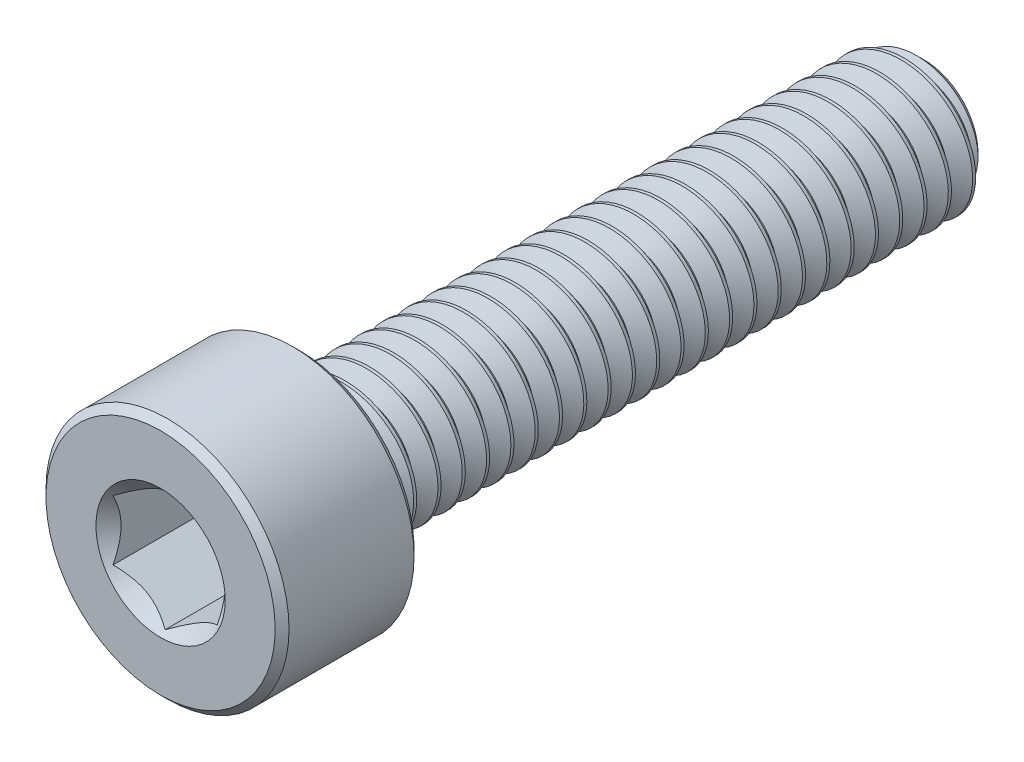
from build123d import *

# Parameters (mm, degrees)
CUT_EXTRUDE1_DEPTH     = 3
SPLIT1_SURFACE_1_BACK  = 25.125
SPLIT1_SURFACE_1_DEPTH = 50.25
SPLIT1_SURFACE_2_BACK  = 25.125
SPLIT1_SURFACE_2_DEPTH = 50.25
CUT_SWEEP1_PITCH       = 0.7
CUT_SWEEP1_TO          = 17.8


with BuildPart() as part:
    # Sketch2 → Revolve1 (revolve)
    with BuildSketch(Plane(origin=(0, 0, 0), x_dir=(0, 0, -1), z_dir=(1, 0, 0))):
        with BuildLine():
            Line((-11, 0), (-11, 3.3))
            Line((-11, 3.3), (-10.8, 3.5))
            Line((-10.8, 3.5), (-7.2, 3.5))
            Line((-7.2, 3.5), (-7, 3.3))
            Line((-7, 3.3), (-7, 2.2))
            ThreePointArc((-7, 2.2), (-6.941421356, 2.058578644), (-6.8, 2))
            Line((-6.8, 2), (10.545336663, 2))
            Line((10.545336663, 2), (11, 1.545336663))
            Line((11, 1.545336663), (11, 0))
            Line((11, 0), (-11, 0))
        make_face()
    revolve(axis=Axis((0, 0, -11), (0, 0, 1)))

    # Sketch3 → Cut-Extrude1 (cut)
    with BuildSketch(Plane.XY.offset(11)):
        Polygon((1.5, -0.866025404), (1.5, 0.866025404), (0, 1.732050808), (-1.5, 0.866025404), (-1.5, -0.866025404), (0, -1.732050808), align=None)
    extrude(amount=-CUT_EXTRUDE1_DEPTH, mode=Mode.SUBTRACT)

    # Cut-Extrude2 cone 1 section (through the dimple's axis) → Cut-Extrude2 (revolve, cut)
    with BuildSketch(Plane(origin=(0, 0, 11), x_dir=(0, -1, 0), z_dir=(1, 0, 0))):
        Polygon((0, 0), (1.861954618, 0), (0, 1.861954618), align=None)
    revolve(axis=Axis((0, 0, 11), (0, 0, -1)), mode=Mode.SUBTRACT)


with BuildPart() as body_2:
    # Split1: the piece behind the surface
    add(part.part)
    # Split1 surface: a surface, the sketch's curves swept straight by 50.25 mm
    with BuildLine(Plane(origin=(0, 0, 0), x_dir=(0, 0, -1), z_dir=(1, 0, 0)).offset(-SPLIT1_SURFACE_1_BACK), mode=Mode.PRIVATE) as split1_surface_1_path:
        Line((-6.8, -3.5), (-6.8, 3.5))
    split1_surface_1 = Shell.extrude(split1_surface_1_path.wire(), (1 * SPLIT1_SURFACE_1_DEPTH, 0 * SPLIT1_SURFACE_1_DEPTH, 0 * SPLIT1_SURFACE_1_DEPTH))
    split(bisect_by=split1_surface_1, keep=Keep.BOTTOM)

    # Cut-Sweep1: arcs per turn and ends read off the stored shape
    # Cut-Sweep1: the profile of Sketch7 screwed along a right-hand helix through 26.714286 turns, 6 arcs to a turn; built about Z, then put on its axis
    cut_sweep1_z = Axis((0, 0, 0), (0, 0, 1))
    cut_sweep1_corners = [(2.037888611, 0, 0.021875), (2.037888611, 0, -0.634375), (1.545336663, 0, -0.35), (1.545336663, 0, -0.2625)]
    with BuildLine(mode=Mode.PRIVATE) as cut_sweep1_profile:
        Line(cut_sweep1_corners[0], cut_sweep1_corners[1])
        Line(cut_sweep1_corners[1], cut_sweep1_corners[2])
        Line(cut_sweep1_corners[2], cut_sweep1_corners[3])
        Line(cut_sweep1_corners[3], cut_sweep1_corners[0])
    cut_sweep1_cap = Face(cut_sweep1_profile.wire())
    cut_sweep1_turn_angles = [0, 30, 60, 90, 120, 150, 180, 210, 240, 270, 300, 330, 360]
    cut_sweep1_turn_weights = [1, 0.8660254037844387, 1, 0.8660254037844387, 1, 0.8660254037844387, 1, 0.8660254037844387, 1, 0.8660254037844387, 1, 0.8660254037844387, 1]
    cut_sweep1_turn_rails = [Edge.make_bspline([Vector(p[0], p[1], 0).rotate(cut_sweep1_z, cut_sweep1_turn_angles[k]) / cut_sweep1_turn_weights[k] + Vector(0, 0, p[2] + CUT_SWEEP1_PITCH * cut_sweep1_turn_angles[k] / 360) for k in range(13)], [0, 0, 0, 1, 1, 2, 2, 3, 3, 4, 4, 5, 5, 6, 6, 6], 2, cut_sweep1_turn_weights) for p in cut_sweep1_corners]
    cut_sweep1_turn_sides = [Face.make_surface_from_curves(cut_sweep1_turn_rails[p[0]], cut_sweep1_turn_rails[p[1]]) for p in [(0, 1), (1, 2), (2, 3), (3, 0)]]
    cut_sweep1_last_angles = [9360, 9390, 9420, 9450, 9480, 9510, 9540, 9570, 9600, 9608.571428571, 9617.142857143]
    cut_sweep1_last_weights = [1, 0.8660254037844387, 1, 0.8660254037844387, 1, 0.8660254037844387, 1, 0.8660254037844387, 1, 0.9888308262249893, 1]
    cut_sweep1_last_rails = [Edge.make_bspline([Vector(p[0], p[1], 0).rotate(cut_sweep1_z, cut_sweep1_last_angles[k]) / cut_sweep1_last_weights[k] + Vector(0, 0, p[2] + CUT_SWEEP1_PITCH * cut_sweep1_last_angles[k] / 360) for k in range(11)], [0, 0, 0, 1, 1, 2, 2, 3, 3, 4, 4, 5, 5, 5], 2, cut_sweep1_last_weights) for p in cut_sweep1_corners]
    cut_sweep1_last_sides = [Face.make_surface_from_curves(cut_sweep1_last_rails[p[0]], cut_sweep1_last_rails[p[1]]) for p in [(0, 1), (1, 2), (2, 3), (3, 0)]]
    cut_sweep1 = Plane(origin=(0, 0, -11), x_dir=(0, 1, 0), z_dir=(0, 0, 1)) * split(Solid(Shell([*[p.moved(Location((0, 0, CUT_SWEEP1_PITCH * i))) for i in range(26) for p in cut_sweep1_turn_sides], *cut_sweep1_last_sides, cut_sweep1_cap, cut_sweep1_cap.rotate(cut_sweep1_z, 9617.142857143).moved(Location((0, 0, CUT_SWEEP1_PITCH * 9617.142857143 / 360)))])), bisect_by=Plane.XY.offset(CUT_SWEEP1_TO), keep=Keep.BOTTOM, mode=Mode.PRIVATE)
    add(cut_sweep1, mode=Mode.SUBTRACT)


with BuildPart() as part_1:
    add(part.part)

    # Split1: split by a surface, the side it looks to stays
    # Split1 surface: a surface, the sketch's curves swept straight by 50.25 mm
    with BuildLine(Plane(origin=(0, 0, 0), x_dir=(0, 0, -1), z_dir=(1, 0, 0)).offset(-SPLIT1_SURFACE_2_BACK), mode=Mode.PRIVATE) as split1_surface_2_path:
        Line((-6.8, -3.5), (-6.8, 3.5))
    split1_surface_2 = Shell.extrude(split1_surface_2_path.wire(), (1 * SPLIT1_SURFACE_2_DEPTH, 0 * SPLIT1_SURFACE_2_DEPTH, 0 * SPLIT1_SURFACE_2_DEPTH))
    split(bisect_by=split1_surface_2, keep=Keep.TOP)

    add(body_2.part)  # Revolve2 merges body 2
    # Sketch8 → Revolve2 (revolve)
    with BuildSketch(Plane(origin=(0, 0, 0), x_dir=(0, 0, -1), z_dir=(1, 0, 0)), mode=Mode.PRIVATE) as revolve2_sk:
        Polygon((-7, 0), (-7, 2), (-6.8, 2), (-5.645299462, 0), align=None)
    revolve(revolve2_sk.sketch.rotate(Axis((0, 0, 5.645299462), (0, 0, 1)), 270), axis=Axis((0, 0, 5.645299462), (0, 0, 1)))


solid = part_1.part
